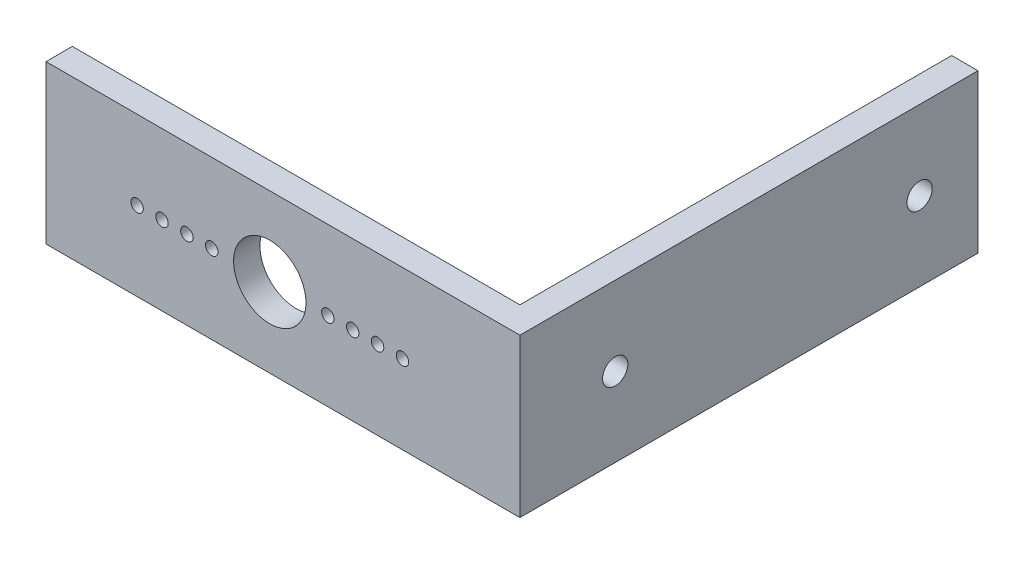
from build123d import *

# Parameters (mm, degrees)
SKETCH1_W           = 53.975
SKETCH1_H           = 19.05
SKETCH1_R           = 0.75
SKETCH1_R_2         = 4.365625
BOSS_EXTRUDE1_DEPTH = 3.175
SKETCH2_W           = 55.245
SKETCH2_H           = 19.05
SKETCH2_R           = 1.524
BOSS_EXTRUDE2_DEPTH = 3.175


with BuildPart() as part:
    # Sketch1 → Boss-Extrude1 (new body)
    with BuildSketch(Plane.XY):
        with Locations((26.9875, 9.525)):
            Rectangle(SKETCH1_W, SKETCH1_H)
        with Locations((33.9875, 9.525)):
            Circle(SKETCH1_R, mode=Mode.SUBTRACT)
        with Locations((42.9875, 9.525)):
            Circle(SKETCH1_R, mode=Mode.SUBTRACT)
        with Locations((36.9875, 9.525)):
            Circle(SKETCH1_R, mode=Mode.SUBTRACT)
        with Locations((39.9875, 9.525)):
            Circle(SKETCH1_R, mode=Mode.SUBTRACT)
        with Locations((19.9875, 9.525)):
            Circle(SKETCH1_R, mode=Mode.SUBTRACT)
        with Locations((16.9875, 9.525)):
            Circle(SKETCH1_R, mode=Mode.SUBTRACT)
        with Locations((13.9875, 9.525)):
            Circle(SKETCH1_R, mode=Mode.SUBTRACT)
        with Locations((10.9875, 9.525)):
            Circle(SKETCH1_R, mode=Mode.SUBTRACT)
        with Locations((26.9875, 9.525)):
            Circle(SKETCH1_R_2, mode=Mode.SUBTRACT)
    extrude(amount=BOSS_EXTRUDE1_DEPTH)

    # Sketch2 → Boss-Extrude2 (add)
    with BuildSketch(Plane(origin=(53.975, 0, 0), x_dir=(0, 0, -1), z_dir=(1, 0, 0))):
        with Locations((24.4475, 9.525)):
            Rectangle(SKETCH2_W, SKETCH2_H)
        with Locations((8.3185, 9.525)):
            Circle(SKETCH2_R, mode=Mode.SUBTRACT)
        with Locations((45.0215, 9.525)):
            Circle(SKETCH2_R, mode=Mode.SUBTRACT)
    extrude(amount=BOSS_EXTRUDE2_DEPTH)


solid = part.part
